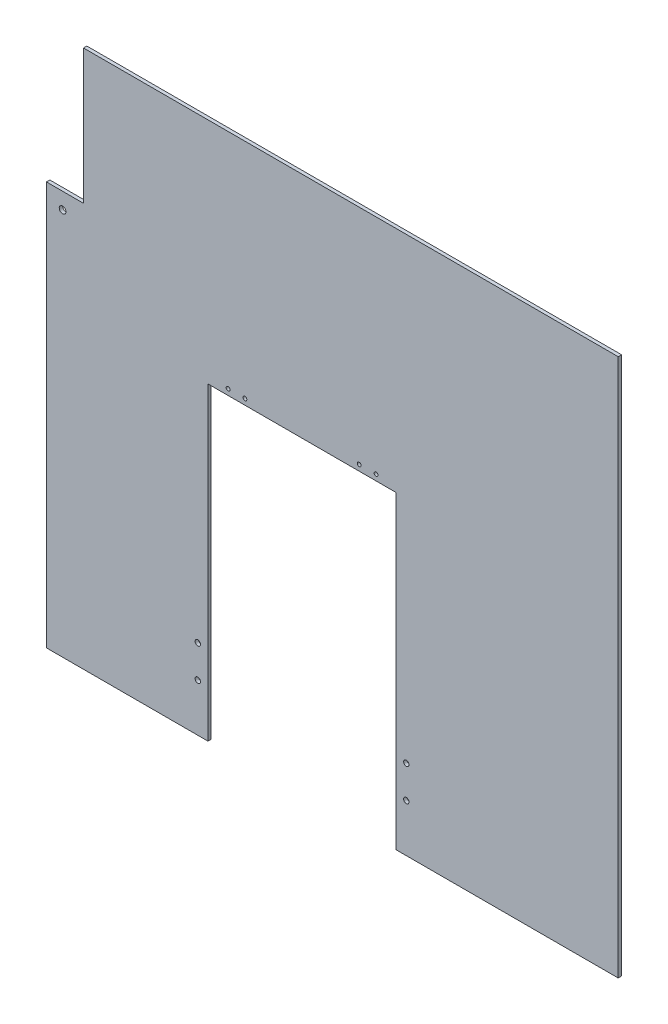
from build123d import *

# Parameters (mm, degrees)
SKETCH1_W           = 539.75
SKETCH1_H           = 508
BOSS_EXTRUDE1_DEPTH = 3.175
SKETCH2_R           = 2.54
SKETCH2_R_2         = 3.175
SKETCH2_W           = 177.8
SKETCH2_H           = 292.1
CUT_EXTRUDE1_DEPTH  = 44.45
SKETCH3_W           = 34.925
SKETCH3_H           = 127
CUT_EXTRUDE2_DEPTH  = 742.218013222
SKETCH4_R           = 1.8034
CUT_EXTRUDE3_DEPTH  = 742.218013222


with BuildPart() as part:
    # Sketch1 → Boss-Extrude1 (new body)
    with BuildSketch(Plane.XY):
        with Locations((269.875, 254)):
            Rectangle(SKETCH1_W, SKETCH1_H)
    extrude(amount=BOSS_EXTRUDE1_DEPTH)

    # Sketch2 → Cut-Extrude1 (cut)
    with BuildSketch(Plane(origin=(0, 0, 0), x_dir=(-1, 0, 0), z_dir=(0, 0, -1))):
        with Locations((-339.725, 45.085)):
            Circle(SKETCH2_R)
        with Locations((-142.875, 45.085)):
            Circle(SKETCH2_R)
        with Locations((-15.24, 365.76)):
            Circle(SKETCH2_R_2)
        with Locations((-339.725, 75.565)):
            Circle(SKETCH2_R)
        with Locations((-142.875, 75.565)):
            Circle(SKETCH2_R)
        with Locations((-241.3, 146.05)):
            Rectangle(SKETCH2_W, SKETCH2_H)
    extrude(amount=-CUT_EXTRUDE1_DEPTH, mode=Mode.SUBTRACT)

    # Sketch3 → Cut-Extrude2 (cut, through all)
    with BuildSketch(Plane(origin=(0, 0, 0), x_dir=(-1, 0, 0), z_dir=(0, 0, -1))):
        with Locations((-17.4625, 444.5)):
            Rectangle(SKETCH3_W, SKETCH3_H)
    extrude(amount=-CUT_EXTRUDE2_DEPTH, mode=Mode.SUBTRACT)

    # Sketch4 → Cut-Extrude3 (cut, through all)
    with BuildSketch(Plane(origin=(0, 0, 0), x_dir=(-1, 0, 0), z_dir=(0, 0, -1))):
        with Locations((-311.1754, 297.6372)):
            Circle(SKETCH4_R)
        with Locations((-295.3004, 297.6372)):
            Circle(SKETCH4_R)
        with Locations((-187.3504, 297.6372)):
            Circle(SKETCH4_R)
        with Locations((-171.4754, 297.6372)):
            Circle(SKETCH4_R)
    extrude(amount=-CUT_EXTRUDE3_DEPTH, mode=Mode.SUBTRACT)


solid = part.part
